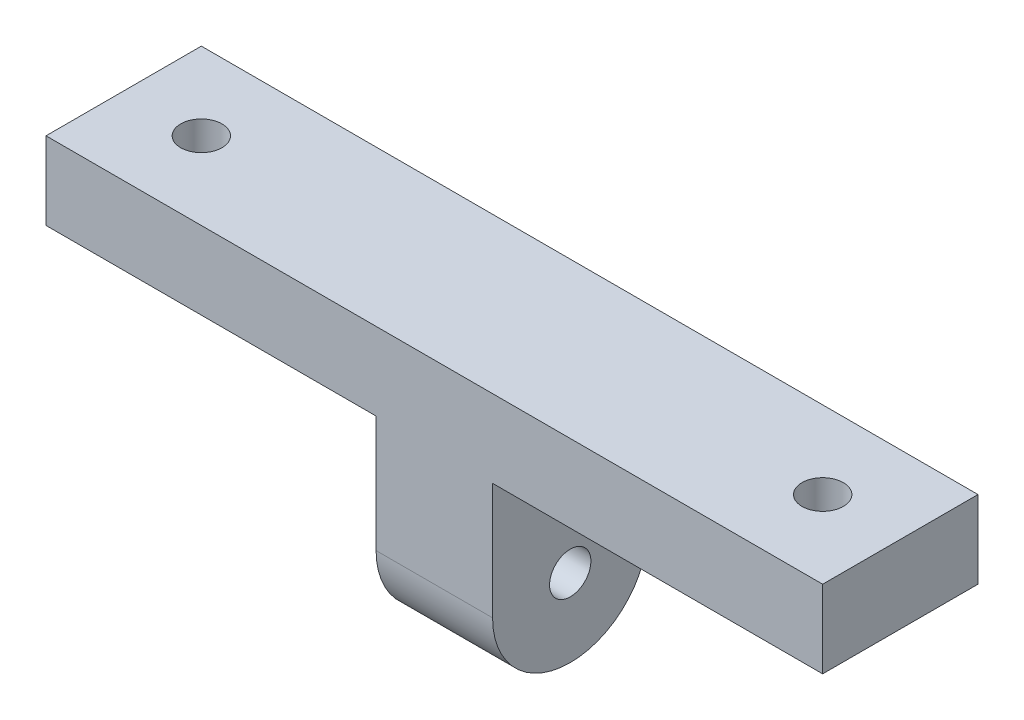
from build123d import *

# Parameters (mm, degrees)
SKETCH1_W           = 19.05
SKETCH1_H           = 12.7
BOSS_EXTRUDE1_DEPTH = 12.7
SKETCH1_3_W         = 19.05
SKETCH1_3_H         = 12.7
BOSS_EXTRUDE2_DEPTH = 31.75
CUT_EXTRUDE1_DEPTH  = 81.63499938
FILLET1_R           = 12.7


with BuildPart() as part:
    # Sketch1 → Boss-Extrude1 (new body)
    with BuildSketch(Plane(origin=(0, 0, 0), x_dir=(1, 0, 0), z_dir=(0, 1, 0))):
        with BuildLine():
            Line((63.5, 12.7), (9.525, 12.7))
            Line((9.525, 12.7), (9.525, 0))
            Line((9.525, 0), (47.4218, 0))
            ThreePointArc((47.4218, 0), (50.8, 3.3782), (54.1782, 0))
            Line((54.1782, 0), (63.5, 0))
            Line((63.5, 0), (63.5, 12.7))
        make_face()
        with BuildLine():
            Line((47.4218, 0), (9.525, 0))
            Line((9.525, 0), (9.525, -12.7))
            Line((9.525, -12.7), (63.5, -12.7))
            Line((63.5, -12.7), (63.5, 0))
            Line((63.5, 0), (54.1782, 0))
            ThreePointArc((54.1782, 0), (50.8, -3.3782), (47.4218, 0))
        make_face()
        with Locations((0, -6.35)):
            Rectangle(SKETCH1_W, SKETCH1_H)
        with Locations((0, 6.35)):
            Rectangle(SKETCH1_W, SKETCH1_H)
        with BuildLine():
            Line((-54.1782, 0), (-63.5, 0))
            Line((-63.5, 0), (-63.5, -12.7))
            Line((-63.5, -12.7), (-9.525, -12.7))
            Line((-9.525, -12.7), (-9.525, 0))
            Line((-9.525, 0), (-47.4218, 0))
            ThreePointArc((-47.4218, 0), (-50.8, -3.3782), (-54.1782, 0))
        make_face()
        with BuildLine():
            Line((-9.525, 12.7), (-63.5, 12.7))
            Line((-63.5, 12.7), (-63.5, 0))
            Line((-63.5, 0), (-54.1782, 0))
            ThreePointArc((-54.1782, 0), (-50.8, 3.3782), (-47.4218, 0))
            Line((-47.4218, 0), (-9.525, 0))
            Line((-9.525, 0), (-9.525, 12.7))
        make_face()
    extrude(amount=BOSS_EXTRUDE1_DEPTH)

    # Sketch1<3> → Boss-Extrude2 (add)
    with BuildSketch(Plane(origin=(0, 0, 0), x_dir=(1, 0, 0), z_dir=(0, 1, 0))):
        with Locations((0, -6.35)):
            Rectangle(SKETCH1_3_W, SKETCH1_3_H)
        with Locations((0, 6.35)):
            Rectangle(SKETCH1_3_W, SKETCH1_3_H)
    extrude(amount=-BOSS_EXTRUDE2_DEPTH)

    # Sketch2 → Cut-Extrude1 (cut, through all)
    with BuildSketch(Plane.ZY.offset(9.525)):
        with BuildLine():
            ThreePointArc((3.3782, -19.05), (2.388748128, -16.661251872), (0, -15.6718))
            Line((0, -15.6718), (0, -22.4282))
            ThreePointArc((0, -22.4282), (2.388748128, -21.438748128), (3.3782, -19.05))
        make_face()
        with BuildLine():
            Line((0, -22.4282), (0, -15.6718))
            ThreePointArc((0, -15.6718), (-3.3782, -19.05), (0, -22.4282))
        make_face()
    extrude(amount=-CUT_EXTRUDE1_DEPTH, mode=Mode.SUBTRACT)

    # Fillet1
    fillet1_edges = [part.edges().sort_by_distance(p)[0] for p in [
        (0, -31.75, -12.7),
        (0, -31.75, 12.7),
    ]]
    fillet(fillet1_edges, radius=FILLET1_R - 0.0001)  # a hair under: the kernel refuses the full size


solid = part.part
